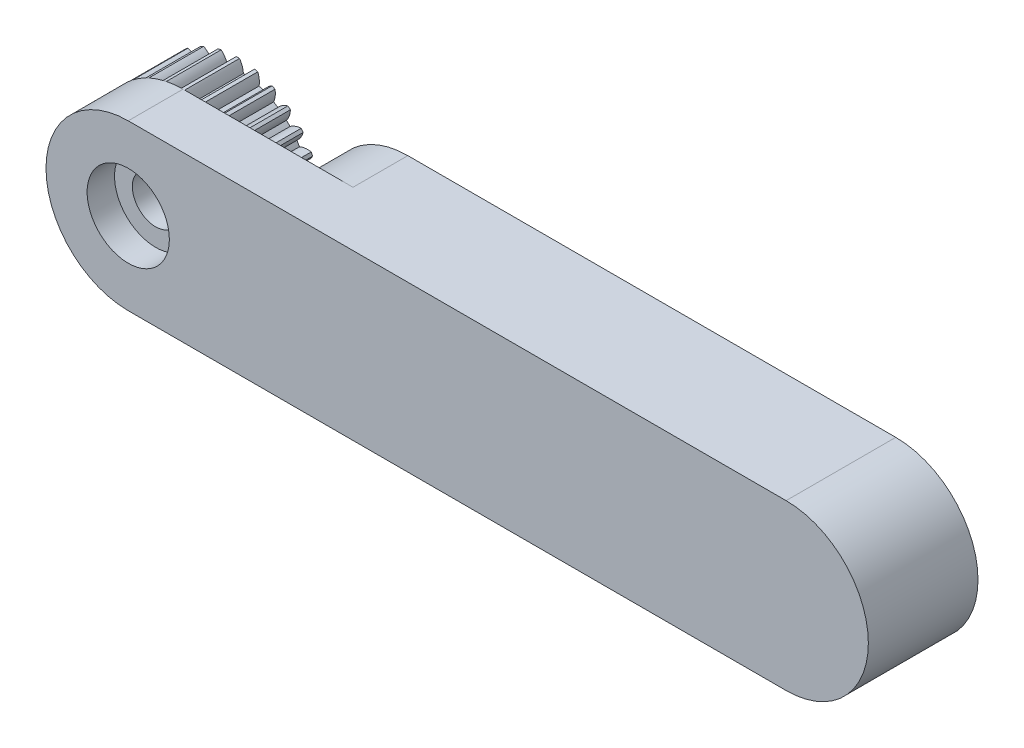
from build123d import *

# Parameters (mm, degrees)
SKETCH2_R           = 13
SKETCH2_R_2         = 4.25
BOSS_EXTRUDE1_DEPTH = 10
BOSS_EXTRUDE2_DEPTH = 10
CIRPATTERN1_COUNT   = 28
SKETCH3_R           = 15
SKETCH3_R_2         = 7.5
BOSS_EXTRUDE3_DEPTH = 10
SKETCH5_R           = 7.5
SKETCH5_R_2         = 4.25
BOSS_EXTRUDE4_DEPTH = 5
BOSS_EXTRUDE5_DEPTH = 20
BOSS_EXTRUDE6_START = -10
BOSS_EXTRUDE6_DEPTH = 10
FILLET1_R           = 15


with BuildPart() as part:
    # Sketch2 → Boss-Extrude1 (new body)
    with BuildSketch(Plane.XY):
        Circle(SKETCH2_R)
        Circle(SKETCH2_R_2, mode=Mode.SUBTRACT)
    extrude(amount=BOSS_EXTRUDE1_DEPTH)

    # Sketch2<3> → Boss-Extrude2 (add)
    with BuildSketch(Plane.XY):
        with BuildLine():
            ThreePointArc((1, 12.961481397), (0.8, 14.03224869), (0.3, 15))
            Line((0.3, 15), (-0.3, 15))
            ThreePointArc((-0.3, 15), (-0.8, 14.03224869), (-1, 12.961481397))
            ThreePointArc((-1, 12.961481397), (0, 13), (1, 12.961481397))
        make_face()
    boss_extrude2 = extrude(amount=BOSS_EXTRUDE2_DEPTH)

    # CirPattern1: Boss-Extrude2 ×28 about axis
    cirpattern1_axis = Axis((0, 0, 0), (0, 0, 1))
    for i in range(1, CIRPATTERN1_COUNT):
        add(boss_extrude2.rotate(cirpattern1_axis, i * 360 / CIRPATTERN1_COUNT))

    # Sketch3 → Boss-Extrude3 (add)
    with BuildSketch(Plane.XY.offset(10)):
        Circle(SKETCH3_R)
        Circle(SKETCH3_R_2, mode=Mode.SUBTRACT)
    extrude(amount=BOSS_EXTRUDE3_DEPTH)

    # Sketch5 → Boss-Extrude4 (add)
    with BuildSketch(Plane.XY.offset(10)):
        Circle(SKETCH5_R)
        Circle(SKETCH5_R_2, mode=Mode.SUBTRACT)
    extrude(amount=BOSS_EXTRUDE4_DEPTH)



with BuildPart() as body_2:
    # Sketch6 → Boss-Extrude5 (new body)
    with BuildSketch(Plane.XY.offset(20)):
        with BuildLine():
            Line((16, 15), (16, -15))
            Line((16, -15), (120, -15))
            ThreePointArc((120, -15), (135, 0), (120, 15))
            Line((120, 15), (16, 15))
        make_face()
    extrude(amount=-BOSS_EXTRUDE5_DEPTH)


with BuildPart() as part_1:
    add(part.part)

    add(body_2.part)  # Boss-Extrude6 merges body 2
    # Sketch6<3> → Boss-Extrude6 (add)
    with BuildSketch(Plane.XY.offset(20).offset(BOSS_EXTRUDE6_START)):
        with BuildLine():
            ThreePointArc((0, 15), (15, 0), (0, -15))
            Line((0, -15), (16, -15))
            Line((16, -15), (16, 15))
            Line((16, 15), (0, 15))
        make_face()
    extrude(amount=BOSS_EXTRUDE6_DEPTH)

    # Fillet1
    fillet1_edges = [part_1.edges().sort_by_distance(p)[0] for p in [
        (16, 15, 5),
        (16, -15, 5),
    ]]
    fillet(fillet1_edges, radius=FILLET1_R - 0.0001)  # a hair under: the kernel refuses the full size


solid = part_1.part
